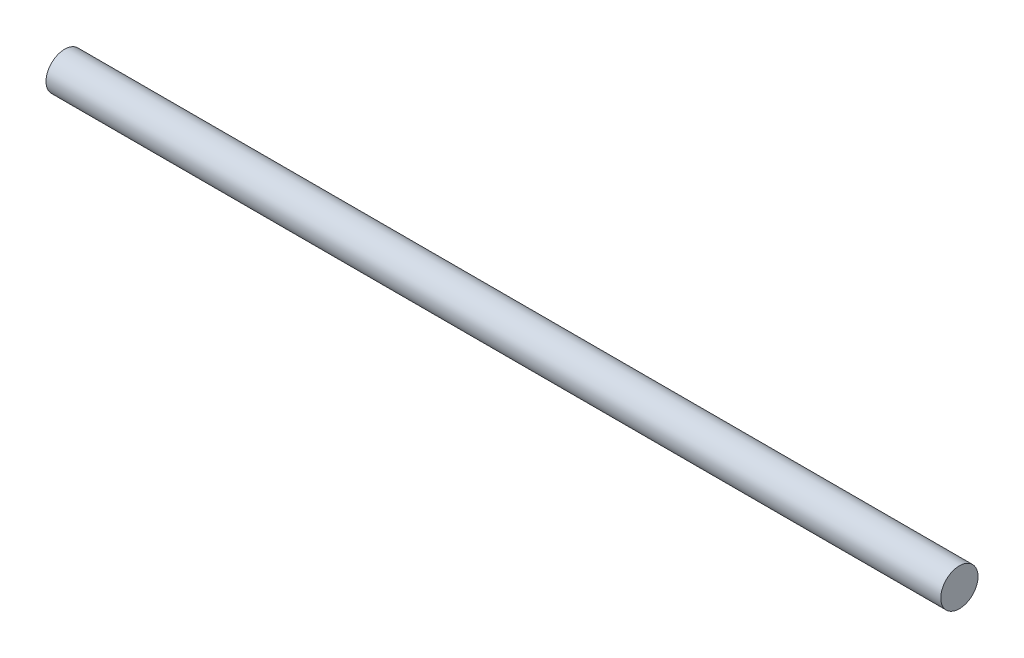
from build123d import *

# Parameters (mm, degrees)
SKETCH1_R           = 6.35
BOSS_EXTRUDE1_DEPTH = 304.8


with BuildPart() as part:
    # Sketch1 → Boss-Extrude1 (new body)
    with BuildSketch(Plane(origin=(0, 0, 0), x_dir=(0, 0, -1), z_dir=(1, 0, 0))):
        Circle(SKETCH1_R)
    extrude(amount=BOSS_EXTRUDE1_DEPTH)


solid = part.part
